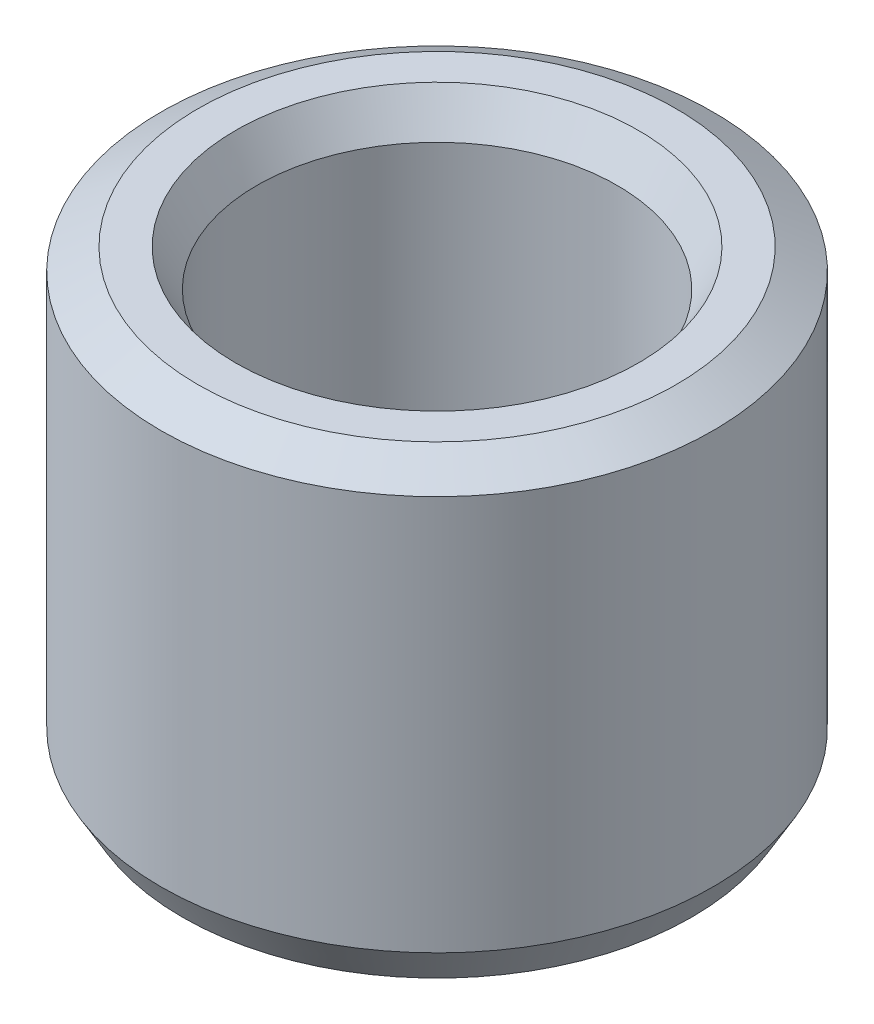
from build123d import *
from OCP.BRepFilletAPI import BRepFilletAPI_MakeChamfer

# Parameters (mm, degrees)
SKETCH1_R           = 47.5
BOSS_EXTRUDE1_DEPTH = 78.012599793
SKETCH2_R           = 30.996169733
CUT_EXTRUDE1_DEPTH  = 103.948850049
CHAMFER1_SIZE       = 3.670185706
CHAMFER1_SIZE2      = 6.356948116


with BuildPart() as part:
    # Sketch1 → Boss-Extrude1 (new body)
    with BuildSketch(Plane(origin=(0, 0, 0), x_dir=(1, 0, 0), z_dir=(0, 1, 0))):
        Circle(SKETCH1_R)
    extrude(amount=BOSS_EXTRUDE1_DEPTH)

    # Sketch2 → Cut-Extrude1 (cut, through all)
    with BuildSketch(Plane(origin=(0, 0, 0), x_dir=(1, 0, 0), z_dir=(0, 1, 0))):
        Circle(SKETCH2_R)
    extrude(amount=CUT_EXTRUDE1_DEPTH, mode=Mode.SUBTRACT)

    # Chamfer1: one chamfer whose edges measure the first distance from different faces: ONE call of the kernel's chamfer builder (chamfer() names one face for all edges)
    chamfer1_edges_1 = [part.edges().sort_by_distance(p)[0] for p in [
        (-30.996169733, 78.012599793, 0),
    ]]
    chamfer1_side_1 = [part.faces().sort_by_distance(p)[0] for p in [
        (-46.156497116, 78.012599793, 0),
    ]]
    chamfer1_edges_2 = [part.edges().sort_by_distance(p)[0] for p in [
        (-30.996169733, 0, 0),
    ]]
    chamfer1_side_2 = [part.faces().sort_by_distance(p)[0] for p in [
        (-30.996169733, 39.006299897, 0),
    ]]
    chamfer1_edges_3 = [part.edges().sort_by_distance(p)[0] for p in [
        (-47.5, 0, 0),
    ]]
    chamfer1_side_3 = [part.faces().sort_by_distance(p)[0] for p in [
        (-46.156497116, 0, 0),
    ]]
    chamfer1_edges_4 = [part.edges().sort_by_distance(p)[0] for p in [
        (-47.5, 78.012599793, 0),
    ]]
    chamfer1_side_4 = [part.faces().sort_by_distance(p)[0] for p in [
        (-47.5, 39.006299897, 0),
    ]]
    chamfer1 = BRepFilletAPI_MakeChamfer(part.part.solid().wrapped)
    for e in chamfer1_edges_1:
        chamfer1.Add(CHAMFER1_SIZE, CHAMFER1_SIZE2, e.wrapped, chamfer1_side_1[0].wrapped)  # the first distance lies on this face
    for e in chamfer1_edges_2:
        chamfer1.Add(CHAMFER1_SIZE, CHAMFER1_SIZE2, e.wrapped, chamfer1_side_2[0].wrapped)  # the first distance lies on this face
    for e in chamfer1_edges_3:
        chamfer1.Add(CHAMFER1_SIZE, CHAMFER1_SIZE2, e.wrapped, chamfer1_side_3[0].wrapped)  # the first distance lies on this face
    for e in chamfer1_edges_4:
        chamfer1.Add(CHAMFER1_SIZE, CHAMFER1_SIZE2, e.wrapped, chamfer1_side_4[0].wrapped)  # the first distance lies on this face
    add(Compound.cast(chamfer1.Shape()), mode=Mode.REPLACE)


solid = part.part
